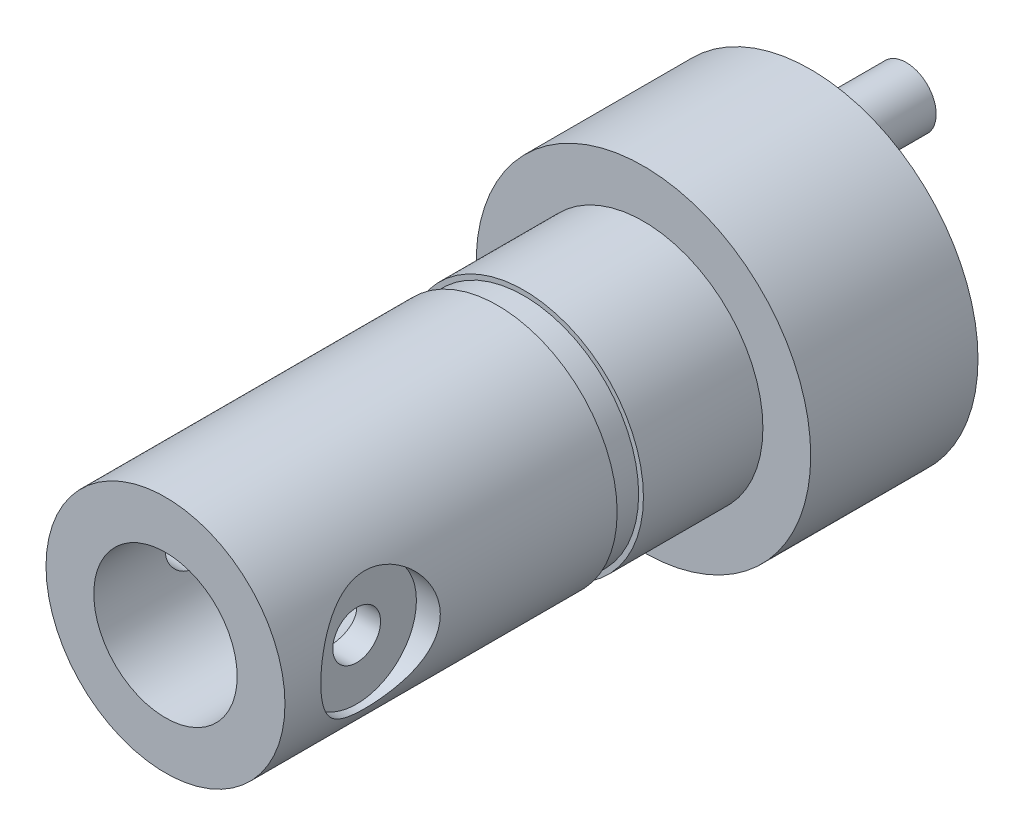
from build123d import *

# Parameters (mm, degrees)
SKETCH1_R           = 7
BOSS_EXTRUDE1_DEPTH = 7
SKETCH2_R           = 5
BOSS_EXTRUDE2_DEPTH = 20
SKETCH3_R           = 6
SKETCH3_R_2         = 4.8
CUT_EXTRUDE1_DEPTH  = 1.1
SKETCH4_R           = 1.25
BOSS_EXTRUDE3_DEPTH = 4
SKETCH5_R           = 1
CUT_EXTRUDE2_DEPTH  = 25.351591324
SKETCH6_R           = 2.5
CUT_EXTRUDE3_DEPTH  = 1
SKETCH7_R           = 3
CUT_EXTRUDE4_DEPTH  = 8


with BuildPart() as part:
    # Sketch1 → Boss-Extrude1 (new body)
    with BuildSketch(Plane.XY):
        Circle(SKETCH1_R)
    extrude(amount=-BOSS_EXTRUDE1_DEPTH)

    # Sketch2 → Boss-Extrude2 (add)
    with BuildSketch(Plane.XY):
        Circle(SKETCH2_R)
    extrude(amount=BOSS_EXTRUDE2_DEPTH)

    # Sketch3 → Cut-Extrude1 (cut)
    with BuildSketch(Plane.XY.offset(5)):
        Circle(SKETCH3_R)
        Circle(SKETCH3_R_2, mode=Mode.SUBTRACT)
    extrude(amount=CUT_EXTRUDE1_DEPTH, mode=Mode.SUBTRACT)

    # Sketch4 → Boss-Extrude3 (add)
    with BuildSketch(Plane(origin=(0, 0, -7), x_dir=(-1, 0, 0), z_dir=(0, 0, -1))):
        with Locations((0, 4)):
            Circle(SKETCH4_R)
    extrude(amount=BOSS_EXTRUDE3_DEPTH)

    # Sketch5 → Cut-Extrude2 (cut, through all)
    with BuildSketch(Plane(origin=(5, 0, 0), x_dir=(0, 0, -1), z_dir=(1, 0, 0))):
        with Locations((-16, 0)):
            Circle(SKETCH5_R)
    extrude(amount=-CUT_EXTRUDE2_DEPTH, mode=Mode.SUBTRACT)

    # Sketch6 → Cut-Extrude3 (cut)
    with BuildSketch(Plane(origin=(5, 0, 0), x_dir=(0, 0, -1), z_dir=(1, 0, 0))):
        with Locations((-16, 0)):
            Circle(SKETCH6_R)
    cut_extrude3 = extrude(amount=-CUT_EXTRUDE3_DEPTH, mode=Mode.SUBTRACT)

    # Mirror1: Cut-Extrude3 across plane
    add(cut_extrude3.mirror(Plane(origin=(0, 0, 0), x_dir=(0, 0, 1), z_dir=(1, 0, 0))), mode=Mode.SUBTRACT)

    # Sketch7 → Cut-Extrude4 (cut)
    with BuildSketch(Plane.XY.offset(20)):
        Circle(SKETCH7_R)
    extrude(amount=-CUT_EXTRUDE4_DEPTH, mode=Mode.SUBTRACT)


solid = part.part
